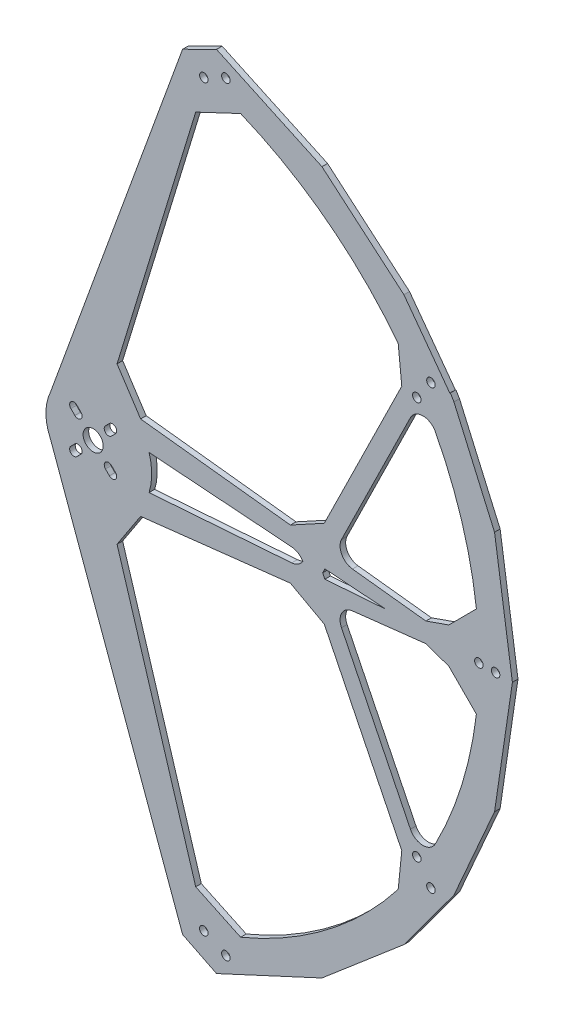
from build123d import *

# Parameters (mm, degrees)
SKETCH_2_R          = 3.6
EXTRUDE_11_DEPTH    = 2
FILLET_5_R          = 5
SKETCH_5_R          = 1.52
CUT_EXTRUDE_3_DEPTH = 6


with BuildPart() as part:
    # 草图2 → 凸台-拉伸11 (new body)
    with BuildSketch(Plane.XY):
        with BuildLine():
            Line((107.388883135, -72.124964906), (56.914082321, -210.803340393))
            ThreePointArc((56.914082321, -210.803340393), (55.330295789, -217.947339524), (56.914082321, -225.091338654))
            Line((56.914082321, -225.091338654), (107.388883135, -363.769714141))
            ThreePointArc((107.388883135, -363.769714141), (222.234437315, -217.947339524), (107.388883135, -72.124964906))
        make_face()
        with BuildLine():
            Line((189.916071161, -290.181620472), (157.944074612, -225.238945101))
            Line((157.944074612, -225.238945101), (210.310247269, -219.299742699))
            ThreePointArc((210.310247269, -219.299742699), (204.933448856, -256.127578193), (189.916071161, -290.181620472))
        make_face(mode=Mode.SUBTRACT)
        with BuildLine():
            Line((151.200700562, -226.003756835), (185.860711742, -296.406424712))
            ThreePointArc((185.860711742, -296.406424712), (153.762269201, -329.392262767), (112.605833628, -349.996226866))
            Line((112.605833628, -349.996226866), (77.261376432, -234.389716496))
            Line((77.261376432, -234.389716496), (151.200700562, -226.003756835))
        make_face(mode=Mode.SUBTRACT)
        with BuildLine():
            ThreePointArc((66.414948515, -225.916432941), (64.265343899, -225.916432938), (64.265343902, -223.766828323))
            Line((64.265343902, -223.766828323), (65.679557463, -222.352614762))
            ThreePointArc((65.679557463, -222.352614762), (67.82916208, -222.352614763), (67.829162079, -224.50221938))
            Line((67.829162079, -224.50221938), (66.414948515, -225.916432941))
        make_face(mode=Mode.SUBTRACT)
        with BuildLine():
            ThreePointArc((80.203581325, -223.913011204), (80.203581325, -226.062615819), (78.05397671, -226.062615819))
            Line((78.05397671, -226.062615819), (76.639763148, -224.648402257))
            ThreePointArc((76.639763148, -224.648402257), (76.639763148, -222.498797642), (78.789367763, -222.498797642))
            Line((78.789367763, -222.498797642), (80.203581325, -223.913011204))
        make_face(mode=Mode.SUBTRACT)
        with BuildLine():
            Line((65.679557463, -213.542064286), (64.265343902, -212.127850725))
            ThreePointArc((64.265343902, -212.127850725), (64.265343899, -209.978246109), (66.414948515, -209.978246107))
            Line((66.414948515, -209.978246107), (67.829162079, -211.392459667))
            ThreePointArc((67.829162079, -211.392459667), (67.82916208, -213.542064284), (65.679557463, -213.542064286))
        make_face(mode=Mode.SUBTRACT)
        with Locations((72.234437315, -217.947339524)):
            Circle(SKETCH_2_R, mode=Mode.SUBTRACT)
        with BuildLine():
            ThreePointArc((78.05397671, -209.832063228), (80.203581325, -209.832063228), (80.203581325, -211.981667843))
            Line((80.203581325, -211.981667843), (78.789367763, -213.395881405))
            ThreePointArc((78.789367763, -213.395881405), (76.639763148, -213.395881405), (76.639763148, -211.24627679))
            Line((76.639763148, -211.24627679), (78.05397671, -209.832063228))
        make_face(mode=Mode.SUBTRACT)
        with BuildLine():
            Line((147.234437315, -217.947339524), (148.271720354, -220.054306337))
            Line((148.271720354, -220.054306337), (92.234437315, -224.163167512))
            ThreePointArc((92.234437315, -224.163167512), (93.178088324, -217.947339524), (92.234437315, -211.731511535))
            Line((92.234437315, -211.731511535), (148.271720354, -215.840372711))
            Line((148.271720354, -215.840372711), (147.234437315, -217.947339524))
        make_face(mode=Mode.SUBTRACT)
        with BuildLine():
            Line((185.860711742, -139.488254335), (151.200700562, -209.890922212))
            Line((151.200700562, -209.890922212), (77.261376432, -201.504962551))
            Line((77.261376432, -201.504962551), (112.605833628, -85.898452181))
            ThreePointArc((112.605833628, -85.898452181), (153.762269201, -106.50241628), (185.860711742, -139.488254335))
        make_face(mode=Mode.SUBTRACT)
        Polygon((155.14355954, -216.344241416), (177.006859024, -217.947339524), (155.14355954, -219.550437632), (154.354336631, -217.947339524), align=None, mode=Mode.SUBTRACT)
        with BuildLine():
            ThreePointArc((189.916071161, -145.713058575), (204.933448856, -179.767100854), (210.310247269, -216.594936349))
            Line((210.310247269, -216.594936349), (157.944074612, -210.655733947))
            Line((157.944074612, -210.655733947), (189.916071161, -145.713058575))
        make_face(mode=Mode.SUBTRACT)
    extrude(amount=EXTRUDE_11_DEPTH)

    # Chamfer 1
    # the kernel refuses this chamfer: 12 mm, written as the material it adds along each edge
    with BuildSketch(Plane(origin=(210.310247269, -216.594936349, 0), x_dir=(-0.04057809096006959, 0.9991763700838988, 0), z_dir=(0, 0, 1))) as chamfer_1_piece_1:
        with BuildLine():
            Line((15.307324317, 0), (1.863391007, 14.502808383))
            Line((1.863391007, 14.502808383), (1.626213789, 14.539509436))
            ThreePointArc((1.626213789, 14.539509436), (0.880460382, 7.259332368), (-0.237177218, 0.036701053))
            Line((-0.237177218, 0.036701053), (-0.007389609, -0.23988621))
            ThreePointArc((-0.007389609, -0.23988621), (7.660156512, -0.263464134), (15.325973079, -0.239274369))
            Line((15.325973079, -0.239274369), (15.307324317, 0))
        make_face()
    extrude(amount=2)
    with BuildSketch(Plane(origin=(210.310247269, -219.299742699, 0), x_dir=(-0.04057809096006077, -0.9991763700838991, 0), z_dir=(0, 0, 1))) as chamfer_1_piece_2:
        with BuildLine():
            Line((15.307324317, 0), (1.863391007, -14.502808383))
            Line((1.863391007, -14.502808383), (1.626213789, -14.539509436))
            ThreePointArc((1.626213789, -14.539509436), (0.880460382, -7.259332368), (-0.237177218, -0.036701053))
            Line((-0.237177218, -0.036701053), (-0.007389609, 0.23988621))
            ThreePointArc((-0.007389609, 0.23988621), (7.660156512, 0.263464134), (15.325973079, 0.239274369))
            Line((15.325973079, 0.239274369), (15.307324317, 0))
        make_face()
    extrude(amount=2)
    with BuildSketch(Plane(origin=(151.200700562, -209.890922212, 0), x_dir=(0.46950316429669464, 0.8829307893121583, 0), z_dir=(0, 0, 1)), Plane(origin=(151.200700562, -226.003756835, 0), x_dir=(-0.9966657367400421, -0.08159294827636017, 0), z_dir=(0, 0, 1))) as chamfer_1_piece_3:
        with BuildLine():
            Line((8.839879124, 0), (-3.499679777, 8.117616915))
            Line((-3.499679777, 8.117616915), (-3.722931757, 8.029534264))
            ThreePointArc((-3.722931757, 8.029534264), (-1.844626591, 4.021410966), (-0.22325198, -0.088082651))
            Line((-0.22325198, -0.088082651), (0.007498883, -0.239882819))
            ThreePointArc((0.007498883, -0.239882819), (4.423123383, -0.101847703), (8.847378007, -0.239882819))
            Line((8.847378007, -0.239882819), (8.839879124, 0))
        make_face()
    extrude(amount=2)
    with BuildSketch(Plane(origin=(185.860711742, -139.488254335, 0), x_dir=(-0.4117163514701049, -0.9113120464100894, 0), z_dir=(0, 0, 1))) as chamfer_1_piece_4:
        with BuildLine():
            Line((7.675639699, 0), (-4.157018363, -6.858301178))
            Line((-4.157018363, -6.858301178), (-4.369107739, -6.745970875))
            ThreePointArc((-4.369107739, -6.745970875), (-2.227190546, -3.345376642), (-0.205585899, 0.123832298))
            Line((-0.205585899, 0.123832298), (0.00795236, 0.239868214))
            ThreePointArc((0.00795236, 0.239868214), (3.841558601, 0.112772515), (7.683592059, 0.239868214))
            Line((7.683592059, 0.239868214), (7.675639699, 0))
        make_face()
    extrude(amount=2)
    with BuildSketch(Plane(origin=(112.605833628, -85.898452181, 0), x_dir=(-0.31859209838878216, -0.9478919109498891, 0), z_dir=(0, 0, 1))) as chamfer_1_piece_5:
        with BuildLine():
            Line((12.900100663, 0), (-0.067782258, 13.500558315))
            Line((-0.067782258, 13.500558315), (-0.307231137, 13.516813604))
            ThreePointArc((-0.307231137, 13.516813604), (-0.2608256, 6.755125197), (-0.239909006, -0.006608248))
            Line((-0.239909006, -0.006608248), (0.006608248, -0.239909006))
            ThreePointArc((0.006608248, -0.239909006), (6.45176853, -0.062378301), (12.906708911, -0.239909006))
            Line((12.906708911, -0.239909006), (12.900100663, 0))
        make_face()
    extrude(amount=2)
    with BuildSketch(Plane(origin=(112.605833628, -349.996226866, 0), x_dir=(-0.31859209838882996, 0.9478919109498731, 0), z_dir=(0, 0, 1))) as chamfer_1_piece_6:
        with BuildLine():
            Line((12.900100663, 0), (-0.067782258, -13.500558315))
            Line((-0.067782258, -13.500558315), (-0.307231137, -13.516813604))
            ThreePointArc((-0.307231137, -13.516813604), (-0.2608256, -6.755125197), (-0.239909006, 0.006608248))
            Line((-0.239909006, 0.006608248), (0.006608248, 0.239909006))
            ThreePointArc((0.006608248, 0.239909006), (6.45176853, 0.062378301), (12.906708911, 0.239909006))
            Line((12.906708911, 0.239909006), (12.900100663, 0))
        make_face()
    extrude(amount=2)
    with BuildSketch(Plane(origin=(185.860711742, -296.406424712, 0), x_dir=(-0.41171635146854524, 0.9113120464107941, 0), z_dir=(0, 0, 1))) as chamfer_1_piece_7:
        with BuildLine():
            Line((7.675639699, 0), (-4.157018363, 6.858301178))
            Line((-4.157018363, 6.858301178), (-4.369107739, 6.745970875))
            ThreePointArc((-4.369107739, 6.745970875), (-2.227190546, 3.345376642), (-0.205585899, -0.123832298))
            Line((-0.205585899, -0.123832298), (0.00795236, -0.239868214))
            ThreePointArc((0.00795236, -0.239868214), (3.841558601, -0.112772515), (7.683592059, -0.239868214))
            Line((7.683592059, -0.239868214), (7.675639699, 0))
        make_face()
    extrude(amount=2)

    # Chamfer 2
    # the kernel refuses this chamfer: 10 mm, written as the material it adds along each edge
    with BuildSketch(Plane(origin=(196.082258358, -220.91343531, 0), x_dir=(0.7285352028351657, -0.685008363620419, 0), z_dir=(0, 0, 1))) as chamfer_2_piece_1:
        with BuildLine():
            Line((5.200036667, 0), (-3.493816465, -3.851444903))
            Line((-3.493816465, -3.851444903), (-3.646365747, -3.722105363))
            ThreePointArc((-3.646365747, -3.722105363), (-1.833031683, -1.852702328), (-0.152549282, 0.12933954))
            Line((-0.152549282, 0.12933954), (0.006699007, 0.199887777))
            ThreePointArc((0.006699007, 0.199887777), (2.603800334, 0.112848941), (5.206735673, 0.199887777))
            Line((5.206735673, 0.199887777), (5.200036667, 0))
        make_face()
    extrude(amount=2)
    with BuildSketch(Plane(origin=(196.082258358, -214.981243737, 0), x_dir=(0.7285352028351658, 0.6850083636204187, 0), z_dir=(0, 0, 1))) as chamfer_2_piece_2:
        with BuildLine():
            Line((5.200036667, 0), (-3.493816465, 3.851444903))
            Line((-3.493816465, 3.851444903), (-3.646365747, 3.722105363))
            ThreePointArc((-3.646365747, 3.722105363), (-1.833031683, 1.852702328), (-0.152549282, -0.12933954))
            Line((-0.152549282, -0.12933954), (0.006699007, -0.199887777))
            ThreePointArc((0.006699007, -0.199887777), (2.603800334, -0.112848941), (5.206735673, -0.199887777))
            Line((5.206735673, -0.199887777), (5.200036667, 0))
        make_face()
    extrude(amount=2)
    with BuildSketch(Plane(origin=(77.261376432, -201.504962551, 0), x_dir=(0.9904977140883607, -0.13752919103132913, 0), z_dir=(0, 0, 1))) as chamfer_2_piece_3:
        with BuildLine():
            Line((12.289505657, 0), (1.638303997, 12.179815652))
            Line((1.638303997, 12.179815652), (1.440818533, 12.211430389))
            ThreePointArc((1.440818533, 12.211430389), (0.773533957, 6.097210654), (-0.197485464, 0.031614737))
            Line((-0.197485464, 0.031614737), (0.005005933, -0.199937342))
            ThreePointArc((0.005005933, -0.199937342), (6.145909171, -0.046184412), (12.294511591, -0.199937342))
            Line((12.294511591, -0.199937342), (12.289505657, 0))
        make_face()
    extrude(amount=2)
    with BuildSketch(Plane(origin=(77.261376432, -234.389716496, 0), x_dir=(0.9904977140883607, 0.13752919103132943, 0), z_dir=(0, 0, 1))) as chamfer_2_piece_4:
        with BuildLine():
            Line((12.289505657, 0), (1.638303997, -12.179815652))
            Line((1.638303997, -12.179815652), (1.440818533, -12.211430389))
            ThreePointArc((1.440818533, -12.211430389), (0.773533957, -6.097210654), (-0.197485464, -0.031614737))
            Line((-0.197485464, -0.031614737), (0.005005933, 0.199937342))
            ThreePointArc((0.005005933, 0.199937342), (6.145909171, 0.046184412), (12.294511591, 0.199937342))
            Line((12.294511591, 0.199937342), (12.289505657, 0))
        make_face()
    extrude(amount=2)
    # the kernel refuses this chamfer: 10 mm, written as the material it takes off along each edge
    with BuildSketch(Plane(origin=(107.388883135, -72.124964906, -24.61098495), x_dir=(-0.3691256030292179, -0.9293795183821926, 0), z_dir=(0, 0, 1))) as chamfer_2_2_piece_1:
        with BuildLine():
            Line((9.512590178, 0), (-1.342175158, 9.752469363))
            Line((-1.342175158, 9.752469363), (-1.541568975, 9.736909614))
            ThreePointArc((-1.541568975, 9.736909614), (-0.812827037, 4.86076704), (-0.198000979, -0.0282066))
            Line((-0.198000979, -0.0282066), (0.005799618, -0.199915893))
            ThreePointArc((0.005799618, -0.199915893), (4.75809519, -0.062050425), (9.518389796, -0.199915893))
            Line((9.518389796, -0.199915893), (9.512590178, 0))
        make_face()
    extrude(amount=51.221969901, mode=Mode.SUBTRACT)
    with BuildSketch(Plane(origin=(107.388883135, -363.769714141, -24.61098495), x_dir=(0.9710274206591367, 0.23896809060639035, 0), z_dir=(0, 0, 1))) as chamfer_2_2_piece_2:
        with BuildLine():
            Line((9.84439398, 0), (-1.296937349, 9.423763866))
            Line((-1.296937349, 9.423763866), (-1.495777189, 9.402252989))
            ThreePointArc((-1.495777189, 9.402252989), (-0.710185112, 4.70520533), (-0.19883984, -0.021510877))
            Line((-0.19883984, -0.021510877), (-0.000947951, -0.199997753))
            ThreePointArc((-0.000947951, -0.199997753), (4.926198402, -0.142524772), (9.856164685, -0.199653326))
            Line((9.856164685, -0.199653326), (9.84439398, 0))
        make_face()
    extrude(amount=51.221969901, mode=Mode.SUBTRACT)

    # 圆角5
    # the kernel refuses this fillet: 5 mm, written as the material it adds along each edge
    with BuildSketch(Plane(origin=(157.944074612, -225.238945101, 0), x_dir=(0.9936297096844121, 0.11269427683991291, 0), z_dir=(0, 0, 1)), Plane(origin=(157.944074612, -210.655733947, 0), x_dir=(0.4416864481656535, 0.8971694831562259, 0), z_dir=(0, 0, 1))) as fillet_5_piece_1:
        with BuildLine():
            CenterArc((FILLET_5_R * 1.42129682706, -FILLET_5_R), FILLET_5_R, 90, 109.7408805)
            Line((FILLET_5_R * 0.480067039112, -FILLET_5_R * 1.33776691116), (FILLET_5_R * 0.461242443353, -FILLET_5_R * 1.34452224938))
            Line((FILLET_5_R * 0.461242443353, -FILLET_5_R * 1.34452224938), (-FILLET_5_R * 0.0284259365413, FILLET_5_R * 0.02))
            Line((-FILLET_5_R * 0.0284259365413, FILLET_5_R * 0.02), (FILLET_5_R * 1.42129682706, FILLET_5_R * 0.02))
            Line((FILLET_5_R * 1.42129682706, FILLET_5_R * 0.02), (FILLET_5_R * 1.42129682706, 0))
        make_face()
    extrude(amount=2)
    with BuildSketch(Plane(origin=(189.916071161, -290.181620472, 0), x_dir=(0.4931058253216027, 0.8699693356859775, 0), z_dir=(0, 0, 1))) as fillet_5_piece_2:
        with BuildLine():
            CenterArc((9.449972722, 4.99696285), FILLET_5_R, 145.756456455, 126.240679893)
            Line((5.3167069, 7.810521744), (5.234041584, 7.866792922))
            Line((5.234041584, 7.866792922), (-0.082665316, 0.056271178))
            Line((-0.082665316, 0.056271178), (-0.003484955, -0.099939257))
            ThreePointArc((-0.003484955, -0.099939257), (4.812110228, -0.183875405), (9.627705411, -0.099939257))
            Line((9.627705411, -0.099939257), (9.624220457, 0))
        make_face()
    extrude(amount=2)
    with BuildSketch(Plane(origin=(189.916071161, -145.713058575, 0), x_dir=(-0.441686448165624, -0.8971694831562403, 0), z_dir=(0, 0, 1))) as fillet_5_piece_3:
        with BuildLine():
            CenterArc((9.448366111, 5), FILLET_5_R, 143.759320107, 126.240679893)
            Line((5.415662212, 7.955892295), (5.335008134, 8.015010141))
            ThreePointArc((5.335008134, 8.015010141), (2.555829921, 4.081415004), (-0.084576128, 0.053356148))
            Line((-0.084576128, 0.053356148), (0, -0.1))
            Line((0, -0.1), (9.448366111, -0.1))
            Line((9.448366111, -0.1), (9.448366111, 0))
        make_face()
    extrude(amount=2)
    with BuildSketch(Plane(origin=(148.271720354, -220.054306337, 0), x_dir=(-0.4416864481656516, 0.8971694831562268, 0), z_dir=(0, 0, 1))) as fillet_5_piece_4:
        with BuildLine():
            CenterArc((6.512579862, 2.767689892), FILLET_5_R, 157.982101281, 55.627972015)
            Line((1.877245935, 4.64217099), (1.784539257, 4.679660612))
            Line((1.784539257, 4.679660612), (-0.092706679, 0.037489622))
            Line((-0.092706679, 0.037489622), (0, -0.1))
            ThreePointArc((0, -0.1), (1.174230094, -0.1), (2.265177794, -0.055353798))
            Line((2.265177794, -0.055353798), (2.348460188, 0))
        make_face()
    extrude(amount=2)
    with BuildSketch(Plane(origin=(148.271720354, -215.840372711, 0), x_dir=(-0.4416864481656566, -0.8971694831562245, 0), z_dir=(0, 0, 1))) as fillet_5_piece_5:
        with BuildLine():
            CenterArc((6.512579862, -2.767689892), FILLET_5_R, 146.389926705, 55.627972015)
            Line((1.877245935, -4.64217099), (1.784539257, -4.679660612))
            Line((1.784539257, -4.679660612), (-0.092706679, -0.037489622))
            Line((-0.092706679, -0.037489622), (0, 0.1))
            ThreePointArc((0, 0.1), (1.174230094, 0.1), (2.265177794, 0.055353798))
            Line((2.265177794, 0.055353798), (2.348460188, 0))
        make_face()
    extrude(amount=2)

    # 草图5 → 切除-拉伸3 (cut)
    with BuildSketch(Plane(origin=(0, 0, 0), x_dir=(-1, 0, 0), z_dir=(0, 0, -1))):
        with Locations((-111.832146931, -85.750435652)):
            Circle(SKETCH_5_R)
        with Locations((-188.030768604, -146.784702019)):
            Circle(SKETCH_5_R)
        with Locations((-210.234437315, -217.947339524)):
            Circle(SKETCH_5_R)
        with BuildLine():
            Line((-154.089131731, -92.250048375), (-115.275426028, -74.255052707))
            ThreePointArc((-115.275426028, -74.255052707), (-135.327130104, -81.861660201), (-154.089131731, -92.250048375))
        make_face()
        with BuildLine():
            Line((-200.030768604, -139.4101018), (-199.835232265, -139.530268661))
            Line((-199.835232265, -139.530268661), (-183.40953034, -117.249282487))
            ThreePointArc((-183.40953034, -117.249282487), (-192.232816003, -127.945177815), (-200.030768604, -139.4101018))
        make_face()
        with Locations((-216.234437315, -217.947339524)):
            Circle(SKETCH_5_R)
        with BuildLine():
            Line((-183.40953034, -117.249282487), (-154.089131731, -92.250048375))
            ThreePointArc((-154.089131731, -92.250048375), (-169.555376154, -103.804293903), (-183.40953034, -117.249282487))
        make_face()
        with BuildLine():
            Line((-215.845433665, -174.635889218), (-201.310072343, -141.530846263))
            ThreePointArc((-201.310072343, -141.530846263), (-209.578842735, -157.643821385), (-215.845433665, -174.635889218))
        make_face()
        with BuildLine():
            ThreePointArc((-154.089131731, -343.644630672), (-135.327130104, -354.033018846), (-115.275426028, -361.63962634))
            Line((-115.275426028, -361.63962634), (-154.089131731, -343.644630672))
        make_face()
        with BuildLine():
            Line((-222.234437315, -217.947339524), (-215.845433665, -174.635889218))
            ThreePointArc((-215.845433665, -174.635889218), (-220.62859059, -196.057267029), (-222.234437315, -217.947339524))
        make_face()
        with BuildLine():
            Line((-215.845433665, -261.258789829), (-222.234437315, -217.947339524))
            ThreePointArc((-222.234437315, -217.947339524), (-220.62859059, -239.837412018), (-215.845433665, -261.258789829))
        make_face()
        with BuildLine():
            ThreePointArc((-183.40953034, -318.64539656), (-169.555376154, -332.090385144), (-154.089131731, -343.644630672))
            Line((-154.089131731, -343.644630672), (-183.40953034, -318.64539656))
        make_face()
        with BuildLine():
            Line((-201.310072343, -294.363832784), (-215.845433665, -261.258789829))
            ThreePointArc((-215.845433665, -261.258789829), (-209.578842735, -278.250857662), (-201.310072343, -294.363832784))
        make_face()
        with BuildLine():
            ThreePointArc((-201.310072343, -294.363832784), (-192.971762395, -306.955756725), (-183.40953034, -318.64539656))
            Line((-183.40953034, -318.64539656), (-201.310072343, -294.363832784))
        make_face()
        with Locations((-119.712465327, -81.999419877)):
            Circle(SKETCH_5_R)
        with Locations((-188.030768604, -289.109977028)):
            Circle(SKETCH_5_R)
        with Locations((-111.832146931, -350.144243395)):
            Circle(SKETCH_5_R)
        with Locations((-193.082303396, -139.641571768)):
            Circle(SKETCH_5_R)
        with Locations((-193.082303396, -296.253107279)):
            Circle(SKETCH_5_R)
        with Locations((-119.712465327, -353.89525917)):
            Circle(SKETCH_5_R)
    extrude(amount=-CUT_EXTRUDE_3_DEPTH, mode=Mode.SUBTRACT)


solid = part.part
